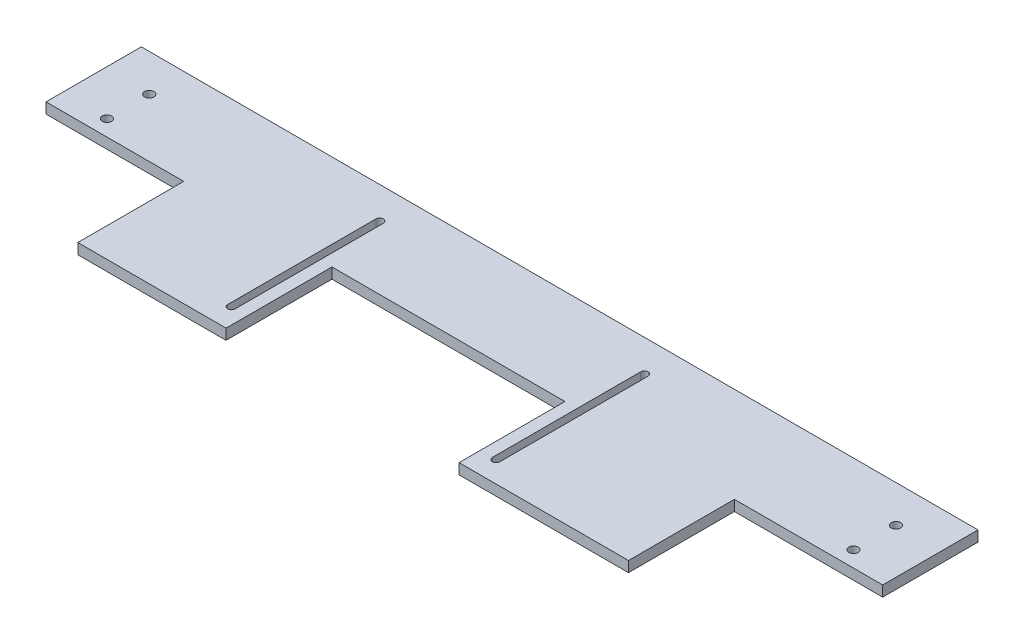
from build123d import *

# Parameters (mm, degrees)
BOSS_EXTRUDE1_DEPTH        = 3.175
SKETCH2_W                  = 101.6
SKETCH2_H                  = 63.5
SKETCH2_W_2                = 88.9
BOSS_EXTRUDE2_DEPTH        = 3.175
CUT_EXTRUDE3_DEPTH         = 268.266362923
F_12_CLEARANCE_HOLE3_D     = 5.6134
F_12_CLEARANCE_HOLE3_DEPTH = 16.51
F_12_CLEARANCE_HOLE3_TIP   = 1.686435499


with BuildPart() as part:
    # Sketch1 → Boss-Extrude1 (new, symmetric)
    with BuildSketch(Plane(origin=(0, 0, 0), x_dir=(1, 0, 0), z_dir=(0, 1, 0))):
        Polygon((-250.825, 28.575), (-250.825, -28.575), (-130.175, -28.575), (-28.575, -28.575), (174.625, -28.575), (250.825, -28.575), (250.825, 28.575), align=None)
    extrude(amount=BOSS_EXTRUDE1_DEPTH, both=True)

    # Sketch2 → Boss-Extrude2 (add, symmetric)
    with BuildSketch(Plane(origin=(0, 0, 0), x_dir=(1, 0, 0), z_dir=(0, 1, 0))):
        with Locations((111.125, -60.325)):
            Rectangle(SKETCH2_W, SKETCH2_H)
        with Locations((-123.825, -60.325)):
            Rectangle(SKETCH2_W_2, SKETCH2_H)
    extrude(amount=BOSS_EXTRUDE2_DEPTH, both=True)

    # Sketch5 → Cut-Extrude3 (cut, through all)
    with BuildSketch(Plane.XZ.offset(3.175)):
        with BuildLine():
            Line((72.0979, -9.525), (72.0979, 79.375))
            ThreePointArc((72.0979, 79.375), (69.85, 81.6229), (67.6021, 79.375))
            Line((67.6021, 79.375), (67.6021, -9.525))
            ThreePointArc((67.6021, -9.525), (69.85, -11.7729), (72.0979, -9.525))
        make_face()
        with BuildLine():
            Line((-86.6521, -9.525), (-86.6521, 79.375))
            ThreePointArc((-86.6521, 79.375), (-88.9, 81.6229), (-91.1479, 79.375))
            Line((-91.1479, 79.375), (-91.1479, -9.525))
            ThreePointArc((-91.1479, -9.525), (-88.9, -11.7729), (-86.6521, -9.525))
        make_face()
    extrude(amount=-CUT_EXTRUDE3_DEPTH, mode=Mode.SUBTRACT)

    # #12 Clearance Hole3
    with Locations(Plane(origin=(0, -3.175, 0), x_dir=(-1, 0, 0), z_dir=(0, -1, 0))):
        with Locations((-223.8375, -19.05), (-223.8375, 6.35), (223.8375, -19.05), (223.8375, 6.35)):
            Hole(F_12_CLEARANCE_HOLE3_D / 2, depth=F_12_CLEARANCE_HOLE3_DEPTH)
            with Locations((0, 0, -(F_12_CLEARANCE_HOLE3_DEPTH + F_12_CLEARANCE_HOLE3_TIP / 2))):  # 118° drill point
                Cone(0, F_12_CLEARANCE_HOLE3_D / 2, F_12_CLEARANCE_HOLE3_TIP, mode=Mode.SUBTRACT)


solid = part.part
